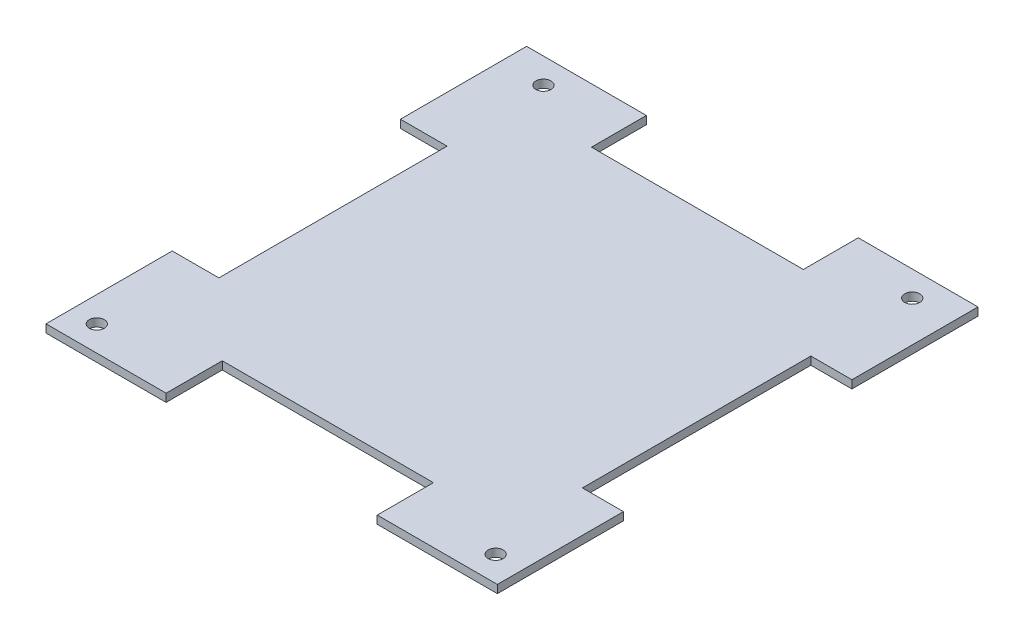
from build123d import *

# Parameters (mm, degrees)
SKETCH2_W           = 84.57
SKETCH2_H           = 90.8
BOSS_EXTRUDE1_DEPTH = 1.6
SKETCH3_R           = 1.5
CUT_EXTRUDE1_DEPTH  = 125.093855206
SKETCH4_W           = 90.8
SKETCH4_H           = 1.6
BOSS_EXTRUDE2_DEPTH = 2.88
SKETCH5_W           = 90.8
SKETCH5_H           = 1.6
BOSS_EXTRUDE3_DEPTH = 2.59
SKETCH6_W           = 90.04
SKETCH6_H           = 1.6
BOSS_EXTRUDE4_DEPTH = 2.54
SKETCH7_W           = 90.04
SKETCH7_H           = 1.6
BOSS_EXTRUDE5_DEPTH = 2.54
SKETCH8_W           = 16.372642976
SKETCH8_H           = 45.571517242
SKETCH8_W_2         = 42.266473234
SKETCH8_H_2         = 21.901065616
SKETCH8_W_3         = 18.617013656
SKETCH8_H_3         = 45.520108402
SKETCH8_W_4         = 42.118702304
SKETCH8_H_4         = 22.400138828
CUT_EXTRUDE2_DEPTH  = 128.915667922


with BuildPart() as part:
    # Sketch2 → Boss-Extrude1 (new body)
    with BuildSketch(Plane(origin=(0, 0, 0), x_dir=(1, 0, 0), z_dir=(0, 1, 0))):
        with Locations((42.285, 45.4)):
            Rectangle(SKETCH2_W, SKETCH2_H)
    extrude(amount=BOSS_EXTRUDE1_DEPTH)

    # Sketch3 → Cut-Extrude1 (cut, through all)
    with BuildSketch(Plane(origin=(0, 1.6, 0), x_dir=(1, 0, 0), z_dir=(0, 1, 0))):
        with Locations((2.5, 2.5)):
            Circle(SKETCH3_R)
        with Locations((82.07, 2.5)):
            Circle(SKETCH3_R)
        with Locations((5.8, 88.3)):
            Circle(SKETCH3_R)
        with Locations((79.37, 88.3)):
            Circle(SKETCH3_R)
    extrude(amount=-CUT_EXTRUDE1_DEPTH, mode=Mode.SUBTRACT)

    # Sketch4 → Boss-Extrude2 (add)
    with BuildSketch(Plane(origin=(84.57, 0, 0), x_dir=(0, 0, -1), z_dir=(1, 0, 0))):
        with Locations((45.4, 0.8)):
            Rectangle(SKETCH4_W, SKETCH4_H)
    extrude(amount=BOSS_EXTRUDE2_DEPTH)

    # Sketch5 → Boss-Extrude3 (add)
    with BuildSketch(Plane.ZY):
        with Locations((-45.4, 0.8)):
            Rectangle(SKETCH5_W, SKETCH5_H)
    extrude(amount=BOSS_EXTRUDE3_DEPTH)

    # Sketch6 → Boss-Extrude4 (add)
    with BuildSketch(Plane(origin=(0, 0, -90.8), x_dir=(-1, 0, 0), z_dir=(0, 0, -1))):
        with Locations((-42.43, 0.8)):
            Rectangle(SKETCH6_W, SKETCH6_H)
    extrude(amount=BOSS_EXTRUDE4_DEPTH)

    # Sketch7 → Boss-Extrude5 (add)
    with BuildSketch(Plane.XY):
        with Locations((42.43, 0.8)):
            Rectangle(SKETCH7_W, SKETCH7_H)
    extrude(amount=BOSS_EXTRUDE5_DEPTH)

    # Sketch8 → Cut-Extrude2 (cut, through all)
    with BuildSketch(Plane(origin=(0, 1.6, 0), x_dir=(1, 0, 0), z_dir=(0, 1, 0))):
        with Locations((87.45, 45.4)):
            Rectangle(SKETCH8_W, SKETCH8_H)
        with Locations((42.43, 93.34)):
            Rectangle(SKETCH8_W_2, SKETCH8_H_2)
        with Locations((-2.59, 45.4)):
            Rectangle(SKETCH8_W_3, SKETCH8_H_3)
        with Locations((42.43, -2.54)):
            Rectangle(SKETCH8_W_4, SKETCH8_H_4)
    extrude(amount=-CUT_EXTRUDE2_DEPTH, mode=Mode.SUBTRACT)


solid = part.part
